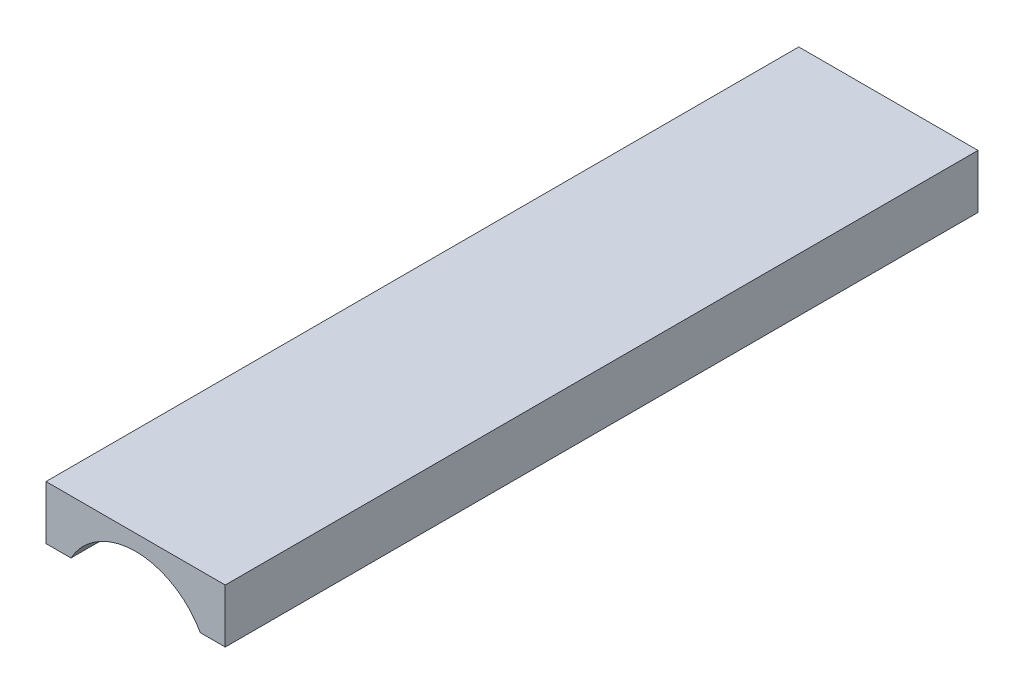
from build123d import *

# Parameters (mm, degrees)
SKETCH2_W           = 63.5
SKETCH2_H           = 63.5
SKETCH2_R           = 26.19375
BOSS_EXTRUDE1_DEPTH = 279.4
BOSS_EXTRUDE2_START = -12.7
SKETCH3_W           = 88.9
SKETCH3_H           = 88.9
SKETCH3_R           = 26.19375
BOSS_EXTRUDE2_DEPTH = 12.7
SKETCH4_W           = 63.5
SKETCH4_H           = 63.5
SKETCH4_R           = 23.114
BOSS_EXTRUDE3_DEPTH = 12.7
SKETCH5_R           = 23.114
SKETCH5_R_2         = 19.05
BOSS_EXTRUDE4_DEPTH = 6.35
CUT_EXTRUDE4_START  = -76.2
CUT_EXTRUDE4_DEPTH  = 88.9


# Read off the part's stored shape, not the designer's step: Cut-Extrude4
with BuildPart() as part:
    # Sketch2 → Boss-Extrude1 (new body)
    with BuildSketch(Plane.XY):
        with Locations((31.75, 31.75)):
            Rectangle(SKETCH2_W, SKETCH2_H)
        with Locations((31.75, 31.75)):
            Circle(SKETCH2_R, mode=Mode.SUBTRACT)
    extrude(amount=BOSS_EXTRUDE1_DEPTH)

    # Sketch3 → Boss-Extrude2 (add)
    with BuildSketch(Plane.XY.offset(279.4).offset(BOSS_EXTRUDE2_START)):
        with Locations((31.75, 31.75)):
            Rectangle(SKETCH3_W, SKETCH3_H)
        with Locations((31.75, 31.75)):
            Circle(SKETCH3_R, mode=Mode.SUBTRACT)
    extrude(amount=BOSS_EXTRUDE2_DEPTH)

    # Sketch4 → Boss-Extrude3 (add)
    with BuildSketch(Plane(origin=(0, 0, 0), x_dir=(-1, 0, 0), z_dir=(0, 0, -1))):
        with Locations((-31.75, 31.75)):
            Rectangle(SKETCH4_W, SKETCH4_H)
        with Locations((-31.75, 31.75)):
            Circle(SKETCH4_R, mode=Mode.SUBTRACT)
    extrude(amount=BOSS_EXTRUDE3_DEPTH)


with BuildPart() as body_2:
    # Sketch5 → Boss-Extrude4 (new body)
    with BuildSketch(Plane(origin=(0, 0, -6.35), x_dir=(-1, 0, 0), z_dir=(0, 0, -1))):
        with Locations((-31.75, 31.75)):
            Circle(SKETCH5_R)
        with Locations((-31.75, 31.75)):
            Circle(SKETCH5_R_2, mode=Mode.SUBTRACT)
    extrude(amount=-BOSS_EXTRUDE4_DEPTH)


with BuildPart() as cut_extrude4_tool:
    # Cut-Extrude4 outline → Cut-Extrude4 (new body)
    with BuildSketch(Plane(origin=(63.5, 0, 0), x_dir=(0, 0, -1), z_dir=(1, 0, 0)).offset(CUT_EXTRUDE4_START)):
        Polygon((-266.7, 44.45), (-266.7, 76.2), (-279.4, 76.2), (-279.4, -12.7), (-266.7, -12.7), (-266.7, 0), (12.7, 0), (12.7, 63.5), (0, 63.5), (0, 44.45), align=None)
    extrude(amount=CUT_EXTRUDE4_DEPTH)


with BuildPart() as part_1:
    add(part.part)

    # Cut-Extrude4: cut by cut_extrude4_tool
    add(cut_extrude4_tool.part, mode=Mode.SUBTRACT)


with BuildPart() as body_2_1:
    add(body_2.part)

    # Cut-Extrude4: cut by cut_extrude4_tool
    add(cut_extrude4_tool.part, mode=Mode.SUBTRACT)


solid = part_1.part
